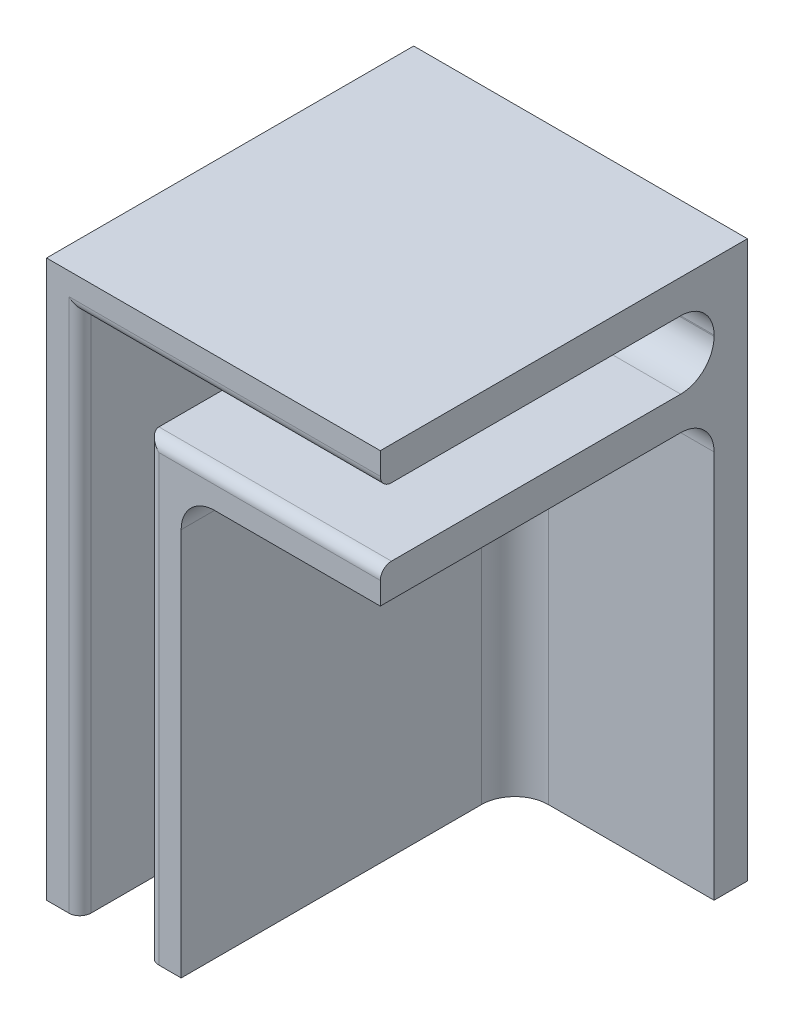
from build123d import *

# Parameters (mm, degrees)
SKETCH1_W           = 30
SKETCH1_H           = 50
BOSS_EXTRUDE1_DEPTH = 3
BOSS_EXTRUDE2_DEPTH = 30
FILLET1_R           = 3
FILLET2_R           = 1


with BuildPart() as part:
    # Sketch1 → Boss-Extrude1 (new body)
    with BuildSketch(Plane.XY):
        with Locations((15, 25)):
            Rectangle(SKETCH1_W, SKETCH1_H)
    extrude(amount=BOSS_EXTRUDE1_DEPTH)

    # Sketch2 → Boss-Extrude2 (add)
    with BuildSketch(Plane.XY.offset(3)):
        Polygon((30, 40.9), (9.1, 40.9), (9.1, 0), (12.1, 0), (12.1, 37.9), (30, 37.9), align=None)
        Polygon((0, 50), (30, 50), (30, 47), (3, 47), (3, 0), (0, 0), (0, 49), align=None)
    extrude(amount=BOSS_EXTRUDE2_DEPTH)

    # Fillet1
    fillet1_edges = [part.edges().sort_by_distance(p)[0] for p in [
        (19.55, 40.9, 3),
        (16.5, 47, 3),
        (12.1, 37.9, 18),
        (21.05, 37.9, 3),
        (12.1, 18.95, 3),
        (9.1, 20.45, 3),
        (3, 23.5, 3),
    ]]
    fillet(fillet1_edges, radius=FILLET1_R)

    # Fillet2
    fillet2_edges = [part.edges().sort_by_distance(p)[0] for p in [
        (3, 23.5, 33),
        (16.5, 47, 33),
        (19.55, 40.9, 33),
        (9.1, 20.45, 33),
    ]]
    fillet(fillet2_edges, radius=FILLET2_R)


solid = part.part
